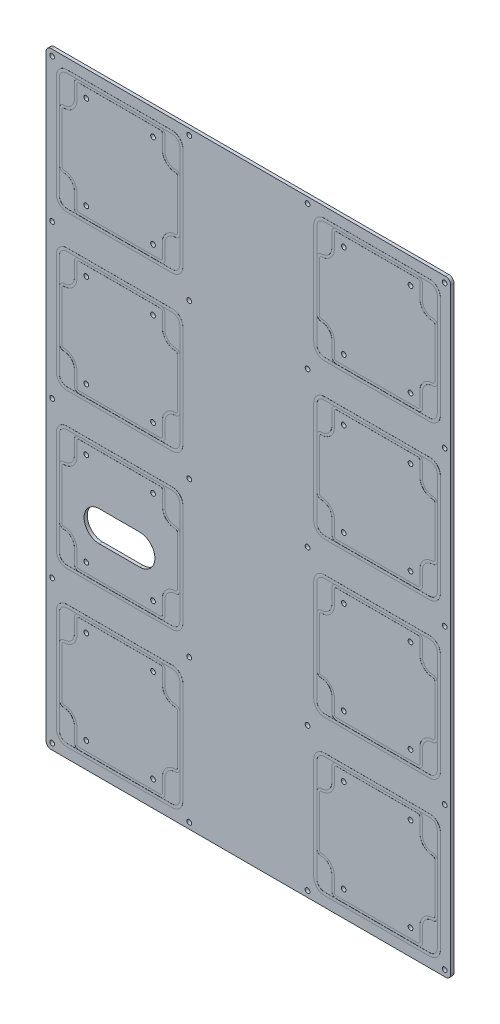
from build123d import *

# Parameters (mm, degrees)
SKETCH1_W            = 254
SKETCH1_H            = 381
BOSS_EXTRUDE1_DEPTH  = 2.032
SKETCH2_R            = 1.4732
CUT_EXTRUDE1_DEPTH   = 458.909520565
FILLET1_R            = 3.175
CUT_EXTRUDE2_DEPTH   = 0.0508
BOSS_EXTRUDE2_DEPTH  = 0.0508
SKETCH5_R            = 1.4732
CUT_EXTRUDE3_DEPTH   = 458.909520565
LPATTERN1_COUNT      = 4
LPATTERN1_PITCH      = 96.8756
LPATTERN1_COUNT_DIR2 = 2
LPATTERN1_PITCH_DIR2 = 161.5948
CUT_EXTRUDE4_DEPTH   = 2.54


with BuildPart() as part:
    # Sketch1 → Boss-Extrude1 (new body)
    with BuildSketch(Plane.XY):
        with Locations((127, 190.5)):
            Rectangle(SKETCH1_W, SKETCH1_H)
    extrude(amount=BOSS_EXTRUDE1_DEPTH)

    # Sketch2 → Cut-Extrude1 (cut, through all)
    with BuildSketch(Plane.XY.offset(2.032)):
        with Locations((3.81, 377.19)):
            Circle(SKETCH2_R)
        with Locations((89.8652, 377.19)):
            Circle(SKETCH2_R)
        with Locations((164.1348, 377.19)):
            Circle(SKETCH2_R)
        with Locations((250.19, 377.19)):
            Circle(SKETCH2_R)
        with Locations((164.1348, 287.375451288)):
            Circle(SKETCH2_R)
        with Locations((3.81, 287.3756)):
            Circle(SKETCH2_R)
        with Locations((250.19, 287.3756)):
            Circle(SKETCH2_R)
        with Locations((89.8652, 287.3756)):
            Circle(SKETCH2_R)
        with Locations((164.1348, 190.499990436)):
            Circle(SKETCH2_R)
        with Locations((3.81, 191.135)):
            Circle(SKETCH2_R)
        with Locations((250.19, 190.5)):
            Circle(SKETCH2_R)
        with Locations((89.8652, 190.5)):
            Circle(SKETCH2_R)
        with Locations((164.1348, 93.6244)):
            Circle(SKETCH2_R)
        with Locations((3.81, 93.6244)):
            Circle(SKETCH2_R)
        with Locations((250.19, 93.6244)):
            Circle(SKETCH2_R)
        with Locations((89.8652, 93.6244)):
            Circle(SKETCH2_R)
        with Locations((164.1348, 3.81)):
            Circle(SKETCH2_R)
        with Locations((3.81, 3.81)):
            Circle(SKETCH2_R)
        with Locations((250.19, 3.81)):
            Circle(SKETCH2_R)
        with Locations((89.8652, 3.81)):
            Circle(SKETCH2_R)
    extrude(amount=-CUT_EXTRUDE1_DEPTH, mode=Mode.SUBTRACT)

    # Fillet1
    fillet1_edges = [part.edges().sort_by_distance(p)[0] for p in [
        (254, 0, 1.016),
        (0, 0, 1.016),
        (254, 381, 1.016),
        (0, 381, 1.016),
    ]]
    fillet(fillet1_edges, radius=FILLET1_R)

    # Sketch3 → Cut-Extrude2 (cut)
    with BuildSketch(Plane.XY.offset(2.032)):
        with BuildLine():
            Line((17.78, 79.1718), (17.78, 70.1802))
            ThreePointArc((17.78, 70.1802), (15.853172671, 65.528427329), (11.2014, 63.6016))
            ThreePointArc((11.2014, 63.6016), (9.207783141, 62.775816859), (8.382, 60.7822))
            Line((8.382, 60.7822), (8.382, 29.591))
            ThreePointArc((8.382, 29.591), (9.207783141, 27.597383141), (11.2014, 26.7716))
            ThreePointArc((11.2014, 26.7716), (15.853172671, 24.844772671), (17.78, 20.193))
            Line((17.78, 20.193), (17.78, 11.2014))
            ThreePointArc((17.78, 11.2014), (18.605783141, 9.207783141), (20.5994, 8.382))
            Line((20.5994, 8.382), (71.8058, 8.382))
            ThreePointArc((71.8058, 8.382), (73.799416859, 9.207783141), (74.6252, 11.2014))
            Line((74.6252, 11.2014), (74.6252, 20.193))
            ThreePointArc((74.6252, 20.193), (76.552027329, 24.844772671), (81.2038, 26.7716))
            ThreePointArc((81.2038, 26.7716), (83.197416859, 27.597383141), (84.0232, 29.591))
            Line((84.0232, 29.591), (84.0232, 60.7822))
            ThreePointArc((84.0232, 60.7822), (83.197416859, 62.775816859), (81.2038, 63.6016))
            ThreePointArc((81.2038, 63.6016), (76.552027329, 65.528427329), (74.6252, 70.1802))
            Line((74.6252, 70.1802), (74.6252, 79.1718))
            ThreePointArc((74.6252, 79.1718), (73.799416859, 81.165416859), (71.8058, 81.9912))
            Line((71.8058, 81.9912), (20.5994, 81.9912))
            ThreePointArc((20.5994, 81.9912), (18.605783141, 81.165416859), (17.78, 79.1718))
        make_face()
        with BuildLine():
            Line((82.4357, 29.591), (82.4357, 60.7822))
            ThreePointArc((82.4357, 60.7822), (82.074884844, 61.653284844), (81.2038, 62.0141))
            ThreePointArc((81.2038, 62.0141), (75.429495314, 64.405895314), (73.0377, 70.1802))
            Line((73.0377, 70.1802), (73.0377, 79.1718))
            ThreePointArc((73.0377, 79.1718), (72.676884844, 80.042884844), (71.8058, 80.4037))
            Line((71.8058, 80.4037), (20.5994, 80.4037))
            ThreePointArc((20.5994, 80.4037), (19.728315156, 80.042884844), (19.3675, 79.1718))
            Line((19.3675, 79.1718), (19.3675, 70.1802))
            ThreePointArc((19.3675, 70.1802), (16.975704686, 64.405895314), (11.2014, 62.0141))
            ThreePointArc((11.2014, 62.0141), (10.330315156, 61.653284844), (9.9695, 60.7822))
            Line((9.9695, 60.7822), (9.9695, 29.591))
            ThreePointArc((9.9695, 29.591), (10.330315156, 28.719915156), (11.2014, 28.3591))
            ThreePointArc((11.2014, 28.3591), (16.975704686, 25.967304686), (19.3675, 20.193))
            Line((19.3675, 20.193), (19.3675, 11.2014))
            ThreePointArc((19.3675, 11.2014), (19.728315156, 10.330315156), (20.5994, 9.9695))
            Line((20.5994, 9.9695), (71.8058, 9.9695))
            ThreePointArc((71.8058, 9.9695), (72.676884844, 10.330315156), (73.0377, 11.2014))
            Line((73.0377, 11.2014), (73.0377, 20.193))
            ThreePointArc((73.0377, 20.193), (75.429495314, 25.967304686), (81.2038, 28.3591))
            ThreePointArc((81.2038, 28.3591), (82.074884844, 28.719915156), (82.4357, 29.591))
        make_face(mode=Mode.SUBTRACT)
    cut_extrude2 = extrude(amount=-CUT_EXTRUDE2_DEPTH, mode=Mode.SUBTRACT)

    # Sketch4 → Boss-Extrude2 (add)
    with BuildSketch(Plane.XY.offset(2.032)):
        with BuildLine():
            Line((6.477, 60.7822), (6.477, 77.2287))
            ThreePointArc((6.477, 77.2287), (8.429865536, 81.943334464), (13.1445, 83.8962))
            Line((13.1445, 83.8962), (20.5994, 83.8962))
            Line((20.5994, 83.8962), (79.2607, 83.8962))
            ThreePointArc((79.2607, 83.8962), (83.975334464, 81.943334464), (85.9282, 77.2287))
            Line((85.9282, 77.2287), (85.9282, 13.1445))
            ThreePointArc((85.9282, 13.1445), (83.975334464, 8.429865536), (79.2607, 6.477))
            Line((79.2607, 6.477), (13.1445, 6.477))
            ThreePointArc((13.1445, 6.477), (8.429865536, 8.429865536), (6.477, 13.1445))
            Line((6.477, 13.1445), (6.477, 60.7822))
        make_face()
        with BuildLine():
            Line((8.382, 60.7822), (8.382, 77.2287))
            ThreePointArc((8.382, 77.2287), (9.776903955, 80.596296045), (13.1445, 81.9912))
            Line((13.1445, 81.9912), (20.5994, 81.9912))
            Line((20.5994, 81.9912), (79.2607, 81.9912))
            ThreePointArc((79.2607, 81.9912), (82.628296045, 80.596296045), (84.0232, 77.2287))
            Line((84.0232, 77.2287), (84.0232, 13.1445))
            ThreePointArc((84.0232, 13.1445), (82.628296045, 9.776903955), (79.2607, 8.382))
            Line((79.2607, 8.382), (13.1445, 8.382))
            ThreePointArc((13.1445, 8.382), (9.776903955, 9.776903955), (8.382, 13.1445))
            Line((8.382, 13.1445), (8.382, 60.7822))
        make_face(mode=Mode.SUBTRACT)
    boss_extrude2 = extrude(amount=BOSS_EXTRUDE2_DEPTH)

    # Sketch5 → Cut-Extrude3 (cut, through all)
    with BuildSketch(Plane.XY.offset(2.032)):
        with Locations((25.2476, 74.3966)):
            Circle(SKETCH5_R)
        with Locations((67.1576, 74.3966)):
            Circle(SKETCH5_R)
        with Locations((67.1576, 15.9766)):
            Circle(SKETCH5_R)
        with Locations((25.2476, 15.9766)):
            Circle(SKETCH5_R)
    cut_extrude3 = extrude(amount=-CUT_EXTRUDE3_DEPTH, mode=Mode.SUBTRACT)

    # LPattern1: Cut-Extrude2, Boss-Extrude2, Cut-Extrude3 4 × 2
    with Locations(*[(j * LPATTERN1_PITCH_DIR2, i * LPATTERN1_PITCH, 0) for i in range(LPATTERN1_COUNT) for j in range(LPATTERN1_COUNT_DIR2) if (i, j) != (0, 0)]):
        add(cut_extrude2, mode=Mode.SUBTRACT)
        add(boss_extrude2)
        add(cut_extrude3, mode=Mode.SUBTRACT)

    # Sketch6 → Cut-Extrude4 (cut)
    with BuildSketch(Plane.XY.offset(2.032)):
        with BuildLine():
            Line((33.401, 145.9865), (58.801, 145.9865))
            ThreePointArc((58.801, 145.9865), (68.326, 136.4615), (58.801, 126.9365))
            Line((58.801, 126.9365), (33.401, 126.9365))
            ThreePointArc((33.401, 126.9365), (23.876, 136.4615), (33.401, 145.9865))
        make_face()
    extrude(amount=-CUT_EXTRUDE4_DEPTH, mode=Mode.SUBTRACT)


solid = part.part
